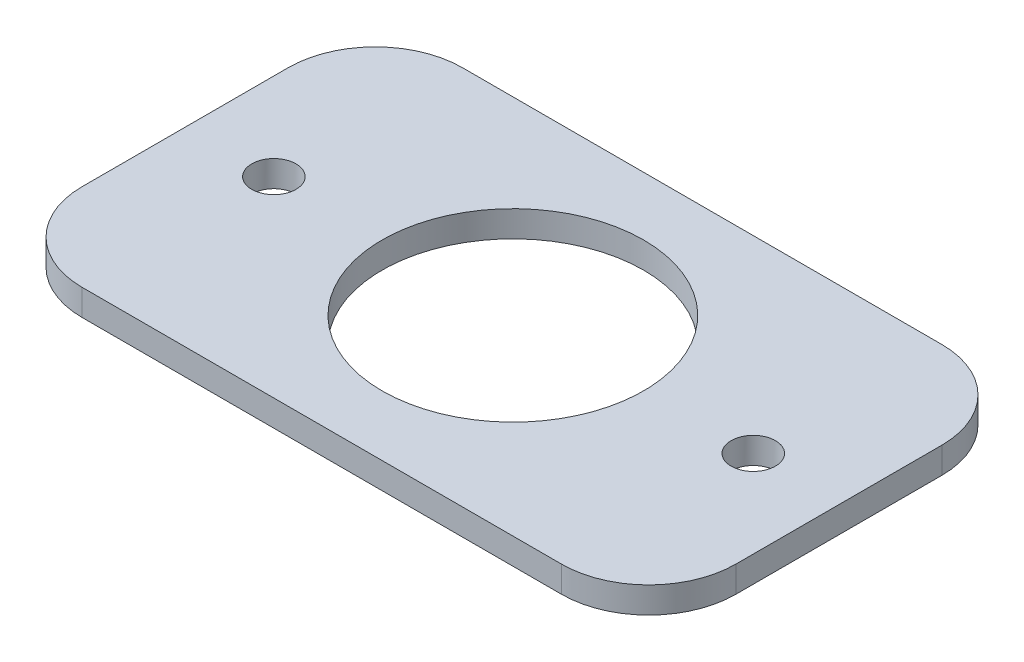
from build123d import *

# Parameters (mm, degrees)
SKETCH_1_W             = 75
SKETCH_1_H             = 43.638217254
SM_BASE_FLANGE_1_DEPTH = 3
SKETCH_8_R             = 15
CUT_EXTRUDE_1_DEPTH    = 74.36050648
FILLET_1_R             = 10
SKETCH_9_R             = 2.54
CUT_EXTRUDE_2_DEPTH    = 10


# Sheet-metal steps are written as plain solids
with BuildPart() as part:
    # Sketch 1 → 基体-法兰1 (new body)
    with BuildSketch(Plane(origin=(0, 0, 0), x_dir=(1, 0, 0), z_dir=(0, 1, 0))):
        with Locations((27.582223351, 11.901331978)):
            Rectangle(SKETCH_1_W, SKETCH_1_H)
    extrude(amount=-SM_BASE_FLANGE_1_DEPTH)

    # 草图8 → 切除-拉伸1 (cut, through all)
    with BuildSketch(Plane(origin=(0, -3, 0), x_dir=(-1, 0, 0), z_dir=(0, -1, 0))):
        with Locations(Location((-27.582223351, 12, 0), (0, 0, 90))):
            Circle(SKETCH_8_R)
    extrude(amount=-CUT_EXTRUDE_1_DEPTH, mode=Mode.SUBTRACT)

    # 圆角1
    fillet_1_edges = [part.edges().sort_by_distance(p)[0] for p in [
        (65.082223351, -1.5, 9.917776649),
        (-9.917776649, -1.5, 9.917776649),
        (-9.917776649, -1.5, -33.720440605),
        (65.082223351, -1.5, -33.720440605),
    ]]
    fillet(fillet_1_edges, radius=FILLET_1_R)

    # 草图9 → 切除-拉伸2 (cut)
    with BuildSketch(Plane(origin=(0, 0, 0), x_dir=(1, 0, 0), z_dir=(0, 1, 0))):
        with Locations(Location((0.082223351, 12.082223351, 0), (0, 0, 270))):
            Circle(SKETCH_9_R)
        with Locations(Location((55.082223351, 12.082223351, 0), (0, 0, 270))):
            Circle(SKETCH_9_R)
    extrude(amount=-CUT_EXTRUDE_2_DEPTH, mode=Mode.SUBTRACT)


solid = part.part
